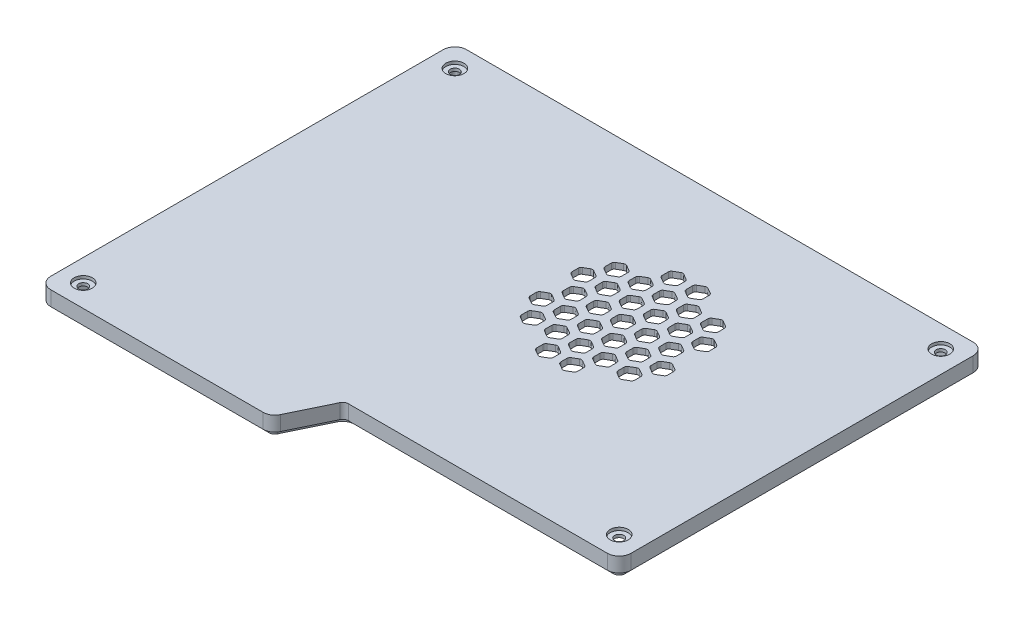
from build123d import *

# Parameters (mm, degrees)
EXTRUDE_1_DEPTH     = 5
CUT_EXTRUDE_1_DEPTH = 3
EXTRUDE_2_DEPTH     = 2
CUT_EXTRUDE_2_DEPTH = 2
FILLET_1_R          = 1
OTHER_START         = 3
OTHER_1_DEPTH       = 2
FILLET_2_R          = 4
FILLET_3_R          = 2
FILLET_4_R          = 1
FILLET_5_R          = 6
SKETCH_8_R          = 1.55
CUT_EXTRUDE_3_DEPTH = 2
SKETCH_9_R          = 3.075
CUT_EXTRUDE_4_DEPTH = 1


# Read off the part's stored shape, not the designer's step: 填充阵列1
with BuildPart() as part:
    # 草图1 → 凸台-拉伸1 (new body)
    with BuildSketch(Plane(origin=(0, 0, 0), x_dir=(1, 0, 0), z_dir=(0, 1, 0))):
        Polygon((0, 0), (0, 141.2), (180, 141.2), (180, 17), (86.8, 17), (78.6, 0), align=None)
    extrude(amount=EXTRUDE_1_DEPTH)

    # 草图4 → 切除-拉伸1 (cut)
    with BuildSketch(Plane.XZ):
        Polygon((4, -4), (4, -137.2), (176, -137.2), (176, -21), (84.288395017, -21), (76.088395017, -4), align=None)
    extrude(amount=-CUT_EXTRUDE_1_DEPTH, mode=Mode.SUBTRACT)

    # 草图5 → 凸台-拉伸2 (add)
    with BuildSketch(Plane.XZ):
        Polygon((2, -2), (2, -139.2), (178, -139.2), (178, -19), (85.544197508, -19), (77.344197508, -2), align=None)
        Polygon((4, -4), (4, -137.2), (176, -137.2), (176, -21), (84.288395017, -21), (76.088395017, -4), align=None, mode=Mode.SUBTRACT)
    extrude(amount=EXTRUDE_2_DEPTH)

    # 草图7 → 切除-拉伸2 (cut)
    with BuildSketch(Plane.XZ.offset(-3)):
        Polygon((110.5, -91.02), (113.314582562, -89.395), (113.314582562, -86.145), (110.5, -84.52), (107.685417438, -86.145), (107.685417438, -89.395), align=None)
    extrude(amount=-CUT_EXTRUDE_2_DEPTH, mode=Mode.SUBTRACT)

    # 圆角1
    fillet_1_edges = [part.edges().sort_by_distance(p)[0] for p in [
        (110.5, 4, -91.02),
        (107.685417438, 4, -89.395),
        (107.685417438, 4, -86.145),
        (110.5, 4, -84.52),
        (113.314582562, 4, -86.145),
        (113.314582562, 4, -89.395),
    ]]
    fillet(fillet_1_edges, radius=FILLET_1_R)

    # 填充阵列1 outline → 填充阵列1 (cut)
    with BuildSketch(Plane(origin=(0, 0, 0), x_dir=(1, 0, 0), z_dir=(0, 1, 0)).offset(OTHER_START)):
        with BuildLine():
            ThreePointArc((123.3, 97.832733176), (122.8, 97.966707773), (122.3, 97.832733176))
            Line((122.3, 97.832733176), (120.485417438, 96.785083446))
            ThreePointArc((120.485417438, 96.785083446), (120.119392034, 96.419058042), (119.985417438, 95.919058042))
            Line((119.985417438, 95.919058042), (119.985417438, 93.82375858))
            ThreePointArc((119.985417438, 93.82375858), (120.119392034, 93.32375858), (120.485417438, 92.957733176))
            Line((120.485417438, 92.957733176), (122.3, 91.910083446))
            ThreePointArc((122.3, 91.910083446), (122.8, 91.776108849), (123.3, 91.910083446))
            Line((123.3, 91.910083446), (125.114582562, 92.957733176))
            ThreePointArc((125.114582562, 92.957733176), (125.480607966, 93.32375858), (125.614582562, 93.82375858))
            Line((125.614582562, 93.82375858), (125.614582562, 95.919058042))
            ThreePointArc((125.614582562, 95.919058042), (125.480607966, 96.419058042), (125.114582562, 96.785083446))
            Line((125.114582562, 96.785083446), (123.3, 97.832733176))
        make_face()
        with BuildLine():
            ThreePointArc((98.7, 83.629916554), (98.2, 83.763891151), (97.7, 83.629916554))
            Line((97.7, 83.629916554), (95.885417438, 82.582266824))
            ThreePointArc((95.885417438, 82.582266824), (95.519392034, 82.21624142), (95.385417438, 81.71624142))
            Line((95.385417438, 81.71624142), (95.385417438, 79.620941958))
            ThreePointArc((95.385417438, 79.620941958), (95.519392034, 79.120941958), (95.885417438, 78.754916554))
            Line((95.885417438, 78.754916554), (97.7, 77.707266824))
            ThreePointArc((97.7, 77.707266824), (98.2, 77.573292227), (98.7, 77.707266824))
            Line((98.7, 77.707266824), (100.514582562, 78.754916554))
            ThreePointArc((100.514582562, 78.754916554), (100.880607966, 79.120941958), (101.014582562, 79.620941958))
            Line((101.014582562, 79.620941958), (101.014582562, 81.71624142))
            ThreePointArc((101.014582562, 81.71624142), (100.880607966, 82.21624142), (100.514582562, 82.582266824))
            Line((100.514582562, 82.582266824), (98.7, 83.629916554))
        make_face()
        with BuildLine():
            ThreePointArc((108.185417438, 75.480858513), (107.819392034, 75.114833109), (107.685417438, 74.614833109))
            Line((107.685417438, 74.614833109), (107.685417438, 72.519533647))
            ThreePointArc((107.685417438, 72.519533647), (107.819392034, 72.019533647), (108.185417438, 71.653508243))
            Line((108.185417438, 71.653508243), (110, 70.605858513))
            ThreePointArc((110, 70.605858513), (110.5, 70.471883916), (111, 70.605858513))
            Line((111, 70.605858513), (112.814582562, 71.653508243))
            ThreePointArc((112.814582562, 71.653508243), (113.180607966, 72.019533647), (113.314582562, 72.519533647))
            Line((113.314582562, 72.519533647), (113.314582562, 74.614833109))
            ThreePointArc((113.314582562, 74.614833109), (113.180607966, 75.114833109), (112.814582562, 75.480858513))
            Line((112.814582562, 75.480858513), (111, 76.528508243))
            ThreePointArc((111, 76.528508243), (110.5, 76.66248284), (110, 76.528508243))
            Line((110, 76.528508243), (108.185417438, 75.480858513))
        make_face()
        with BuildLine():
            ThreePointArc((108.185417438, 103.886491757), (107.819392034, 103.520466353), (107.685417438, 103.020466353))
            Line((107.685417438, 103.020466353), (107.685417438, 100.925166891))
            ThreePointArc((107.685417438, 100.925166891), (107.819392034, 100.425166891), (108.185417438, 100.059141487))
            Line((108.185417438, 100.059141487), (110, 99.011491757))
            ThreePointArc((110, 99.011491757), (110.5, 98.87751716), (111, 99.011491757))
            Line((111, 99.011491757), (112.814582562, 100.059141487))
            ThreePointArc((112.814582562, 100.059141487), (113.180607966, 100.425166891), (113.314582562, 100.925166891))
            Line((113.314582562, 100.925166891), (113.314582562, 103.020466353))
            ThreePointArc((113.314582562, 103.020466353), (113.180607966, 103.520466353), (112.814582562, 103.886491757))
            Line((112.814582562, 103.886491757), (111, 104.934141487))
            ThreePointArc((111, 104.934141487), (110.5, 105.068116084), (110, 104.934141487))
            Line((110, 104.934141487), (108.185417438, 103.886491757))
        make_face()
        with BuildLine():
            ThreePointArc((119.985417438, 79.620941958), (120.119392034, 79.120941958), (120.485417438, 78.754916554))
            Line((120.485417438, 78.754916554), (122.3, 77.707266824))
            ThreePointArc((122.3, 77.707266824), (122.8, 77.573292227), (123.3, 77.707266824))
            Line((123.3, 77.707266824), (125.114582562, 78.754916554))
            ThreePointArc((125.114582562, 78.754916554), (125.480607966, 79.120941958), (125.614582562, 79.620941958))
            Line((125.614582562, 79.620941958), (125.614582562, 81.71624142))
            ThreePointArc((125.614582562, 81.71624142), (125.480607966, 82.21624142), (125.114582562, 82.582266824))
            Line((125.114582562, 82.582266824), (123.3, 83.629916554))
            ThreePointArc((123.3, 83.629916554), (122.8, 83.763891151), (122.3, 83.629916554))
            Line((122.3, 83.629916554), (120.485417438, 82.582266824))
            ThreePointArc((120.485417438, 82.582266824), (120.119392034, 82.21624142), (119.985417438, 81.71624142))
            Line((119.985417438, 81.71624142), (119.985417438, 79.620941958))
        make_face()
        with BuildLine():
            ThreePointArc((95.385417438, 93.82375858), (95.519392034, 93.32375858), (95.885417438, 92.957733176))
            Line((95.885417438, 92.957733176), (97.7, 91.910083446))
            ThreePointArc((97.7, 91.910083446), (98.2, 91.776108849), (98.7, 91.910083446))
            Line((98.7, 91.910083446), (100.514582562, 92.957733176))
            ThreePointArc((100.514582562, 92.957733176), (100.880607966, 93.32375858), (101.014582562, 93.82375858))
            Line((101.014582562, 93.82375858), (101.014582562, 95.919058042))
            ThreePointArc((101.014582562, 95.919058042), (100.880607966, 96.419058042), (100.514582562, 96.785083446))
            Line((100.514582562, 96.785083446), (98.7, 97.832733176))
            ThreePointArc((98.7, 97.832733176), (98.2, 97.966707773), (97.7, 97.832733176))
            Line((97.7, 97.832733176), (95.885417438, 96.785083446))
            ThreePointArc((95.885417438, 96.785083446), (95.519392034, 96.419058042), (95.385417438, 95.919058042))
            Line((95.385417438, 95.919058042), (95.385417438, 93.82375858))
        make_face()
        with BuildLine():
            ThreePointArc((90.5, 97.832733176), (90, 97.966707773), (89.5, 97.832733176))
            Line((89.5, 97.832733176), (87.685417438, 96.785083446))
            ThreePointArc((87.685417438, 96.785083446), (87.319392034, 96.419058042), (87.185417438, 95.919058042))
            Line((87.185417438, 95.919058042), (87.185417438, 93.82375858))
            ThreePointArc((87.185417438, 93.82375858), (87.319392034, 93.32375858), (87.685417438, 92.957733176))
            Line((87.685417438, 92.957733176), (89.5, 91.910083446))
            ThreePointArc((89.5, 91.910083446), (90, 91.776108849), (90.5, 91.910083446))
            Line((90.5, 91.910083446), (92.314582562, 92.957733176))
            ThreePointArc((92.314582562, 92.957733176), (92.680607966, 93.32375858), (92.814582562, 93.82375858))
            Line((92.814582562, 93.82375858), (92.814582562, 95.919058042))
            ThreePointArc((92.814582562, 95.919058042), (92.680607966, 96.419058042), (92.314582562, 96.785083446))
            Line((92.314582562, 96.785083446), (90.5, 97.832733176))
        make_face()
        with BuildLine():
            ThreePointArc((102.8, 104.934141487), (102.3, 105.068116084), (101.8, 104.934141487))
            Line((101.8, 104.934141487), (99.985417438, 103.886491757))
            ThreePointArc((99.985417438, 103.886491757), (99.619392034, 103.520466353), (99.485417438, 103.020466353))
            Line((99.485417438, 103.020466353), (99.485417438, 100.925166891))
            ThreePointArc((99.485417438, 100.925166891), (99.619392034, 100.425166891), (99.985417438, 100.059141487))
            Line((99.985417438, 100.059141487), (101.8, 99.011491757))
            ThreePointArc((101.8, 99.011491757), (102.3, 98.87751716), (102.8, 99.011491757))
            Line((102.8, 99.011491757), (104.614582562, 100.059141487))
            ThreePointArc((104.614582562, 100.059141487), (104.980607966, 100.425166891), (105.114582562, 100.925166891))
            Line((105.114582562, 100.925166891), (105.114582562, 103.020466353))
            ThreePointArc((105.114582562, 103.020466353), (104.980607966, 103.520466353), (104.614582562, 103.886491757))
            Line((104.614582562, 103.886491757), (102.8, 104.934141487))
        make_face()
        with BuildLine():
            ThreePointArc((115.1, 112.035549799), (114.6, 112.169524395), (114.1, 112.035549799))
            Line((114.1, 112.035549799), (112.285417438, 110.987900068))
            ThreePointArc((112.285417438, 110.987900068), (111.919392034, 110.621874664), (111.785417438, 110.121874664))
            Line((111.785417438, 110.121874664), (111.785417438, 108.026575202))
            ThreePointArc((111.785417438, 108.026575202), (111.919392034, 107.526575202), (112.285417438, 107.160549799))
            Line((112.285417438, 107.160549799), (114.1, 106.112900068))
            ThreePointArc((114.1, 106.112900068), (114.6, 105.978925471), (115.1, 106.112900068))
            Line((115.1, 106.112900068), (116.914582562, 107.160549799))
            ThreePointArc((116.914582562, 107.160549799), (117.280607966, 107.526575202), (117.414582562, 108.026575202))
            Line((117.414582562, 108.026575202), (117.414582562, 110.121874664))
            ThreePointArc((117.414582562, 110.121874664), (117.280607966, 110.621874664), (116.914582562, 110.987900068))
            Line((116.914582562, 110.987900068), (115.1, 112.035549799))
        make_face()
        with BuildLine():
            ThreePointArc((87.685417438, 82.582266824), (87.319392034, 82.21624142), (87.185417438, 81.71624142))
            Line((87.185417438, 81.71624142), (87.185417438, 79.620941958))
            ThreePointArc((87.185417438, 79.620941958), (87.319392034, 79.120941958), (87.685417438, 78.754916554))
            Line((87.685417438, 78.754916554), (89.5, 77.707266824))
            ThreePointArc((89.5, 77.707266824), (90, 77.573292227), (90.5, 77.707266824))
            Line((90.5, 77.707266824), (92.314582562, 78.754916554))
            ThreePointArc((92.314582562, 78.754916554), (92.680607966, 79.120941958), (92.814582562, 79.620941958))
            Line((92.814582562, 79.620941958), (92.814582562, 81.71624142))
            ThreePointArc((92.814582562, 81.71624142), (92.680607966, 82.21624142), (92.314582562, 82.582266824))
            Line((92.314582562, 82.582266824), (90.5, 83.629916554))
            ThreePointArc((90.5, 83.629916554), (90, 83.763891151), (89.5, 83.629916554))
            Line((89.5, 83.629916554), (87.685417438, 82.582266824))
        make_face()
        with BuildLine():
            ThreePointArc((111.785417438, 79.620941958), (111.919392034, 79.120941958), (112.285417438, 78.754916554))
            Line((112.285417438, 78.754916554), (114.1, 77.707266824))
            ThreePointArc((114.1, 77.707266824), (114.6, 77.573292227), (115.1, 77.707266824))
            Line((115.1, 77.707266824), (116.914582562, 78.754916554))
            ThreePointArc((116.914582562, 78.754916554), (117.280607966, 79.120941958), (117.414582562, 79.620941958))
            Line((117.414582562, 79.620941958), (117.414582562, 81.71624142))
            ThreePointArc((117.414582562, 81.71624142), (117.280607966, 82.21624142), (116.914582562, 82.582266824))
            Line((116.914582562, 82.582266824), (115.1, 83.629916554))
            ThreePointArc((115.1, 83.629916554), (114.6, 83.763891151), (114.1, 83.629916554))
            Line((114.1, 83.629916554), (112.285417438, 82.582266824))
            ThreePointArc((112.285417438, 82.582266824), (111.919392034, 82.21624142), (111.785417438, 81.71624142))
            Line((111.785417438, 81.71624142), (111.785417438, 79.620941958))
        make_face()
        with BuildLine():
            ThreePointArc((124.085417438, 72.519533647), (124.219392034, 72.019533647), (124.585417438, 71.653508243))
            Line((124.585417438, 71.653508243), (126.4, 70.605858513))
            ThreePointArc((126.4, 70.605858513), (126.9, 70.471883916), (127.4, 70.605858513))
            Line((127.4, 70.605858513), (129.214582562, 71.653508243))
            ThreePointArc((129.214582562, 71.653508243), (129.580607966, 72.019533647), (129.714582562, 72.519533647))
            Line((129.714582562, 72.519533647), (129.714582562, 74.614833109))
            ThreePointArc((129.714582562, 74.614833109), (129.580607966, 75.114833109), (129.214582562, 75.480858513))
            Line((129.214582562, 75.480858513), (127.4, 76.528508243))
            ThreePointArc((127.4, 76.528508243), (126.9, 76.66248284), (126.4, 76.528508243))
            Line((126.4, 76.528508243), (124.585417438, 75.480858513))
            ThreePointArc((124.585417438, 75.480858513), (124.219392034, 75.114833109), (124.085417438, 74.614833109))
            Line((124.085417438, 74.614833109), (124.085417438, 72.519533647))
        make_face()
        with BuildLine():
            ThreePointArc((99.485417438, 86.722350269), (99.619392034, 86.222350269), (99.985417438, 85.856324865))
            Line((99.985417438, 85.856324865), (101.8, 84.808675135))
            ThreePointArc((101.8, 84.808675135), (102.3, 84.674700538), (102.8, 84.808675135))
            Line((102.8, 84.808675135), (104.614582562, 85.856324865))
            ThreePointArc((104.614582562, 85.856324865), (104.980607966, 86.222350269), (105.114582562, 86.722350269))
            Line((105.114582562, 86.722350269), (105.114582562, 88.817649731))
            ThreePointArc((105.114582562, 88.817649731), (104.980607966, 89.317649731), (104.614582562, 89.683675135))
            Line((104.614582562, 89.683675135), (102.8, 90.731324865))
            ThreePointArc((102.8, 90.731324865), (102.3, 90.865299462), (101.8, 90.731324865))
            Line((101.8, 90.731324865), (99.985417438, 89.683675135))
            ThreePointArc((99.985417438, 89.683675135), (99.619392034, 89.317649731), (99.485417438, 88.817649731))
            Line((99.485417438, 88.817649731), (99.485417438, 86.722350269))
        make_face()
        with BuildLine():
            ThreePointArc((119.2, 76.528508243), (118.7, 76.66248284), (118.2, 76.528508243))
            Line((118.2, 76.528508243), (116.385417438, 75.480858513))
            ThreePointArc((116.385417438, 75.480858513), (116.019392034, 75.114833109), (115.885417438, 74.614833109))
            Line((115.885417438, 74.614833109), (115.885417438, 72.519533647))
            ThreePointArc((115.885417438, 72.519533647), (116.019392034, 72.019533647), (116.385417438, 71.653508243))
            Line((116.385417438, 71.653508243), (118.2, 70.605858513))
            ThreePointArc((118.2, 70.605858513), (118.7, 70.471883916), (119.2, 70.605858513))
            Line((119.2, 70.605858513), (121.014582562, 71.653508243))
            ThreePointArc((121.014582562, 71.653508243), (121.380607966, 72.019533647), (121.514582562, 72.519533647))
            Line((121.514582562, 72.519533647), (121.514582562, 74.614833109))
            ThreePointArc((121.514582562, 74.614833109), (121.380607966, 75.114833109), (121.014582562, 75.480858513))
            Line((121.014582562, 75.480858513), (119.2, 76.528508243))
        make_face()
        with BuildLine():
            ThreePointArc((106.9, 69.427099932), (106.4, 69.561074529), (105.9, 69.427099932))
            Line((105.9, 69.427099932), (104.085417438, 68.379450201))
            ThreePointArc((104.085417438, 68.379450201), (103.719392034, 68.013424798), (103.585417438, 67.513424798))
            Line((103.585417438, 67.513424798), (103.585417438, 65.418125336))
            ThreePointArc((103.585417438, 65.418125336), (103.719392034, 64.918125336), (104.085417438, 64.552099932))
            Line((104.085417438, 64.552099932), (105.9, 63.504450201))
            ThreePointArc((105.9, 63.504450201), (106.4, 63.370475605), (106.9, 63.504450201))
            Line((106.9, 63.504450201), (108.714582562, 64.552099932))
            ThreePointArc((108.714582562, 64.552099932), (109.080607966, 64.918125336), (109.214582562, 65.418125336))
            Line((109.214582562, 65.418125336), (109.214582562, 67.513424798))
            ThreePointArc((109.214582562, 67.513424798), (109.080607966, 68.013424798), (108.714582562, 68.379450201))
            Line((108.714582562, 68.379450201), (106.9, 69.427099932))
        make_face()
        with BuildLine():
            ThreePointArc((131.5, 83.629916554), (131, 83.763891151), (130.5, 83.629916554))
            Line((130.5, 83.629916554), (128.685417438, 82.582266824))
            ThreePointArc((128.685417438, 82.582266824), (128.319392034, 82.21624142), (128.185417438, 81.71624142))
            Line((128.185417438, 81.71624142), (128.185417438, 79.620941958))
            ThreePointArc((128.185417438, 79.620941958), (128.319392034, 79.120941958), (128.685417438, 78.754916554))
            Line((128.685417438, 78.754916554), (130.5, 77.707266824))
            ThreePointArc((130.5, 77.707266824), (131, 77.573292227), (131.5, 77.707266824))
            Line((131.5, 77.707266824), (133.314582562, 78.754916554))
            ThreePointArc((133.314582562, 78.754916554), (133.680607966, 79.120941958), (133.814582562, 79.620941958))
            Line((133.814582562, 79.620941958), (133.814582562, 81.71624142))
            ThreePointArc((133.814582562, 81.71624142), (133.680607966, 82.21624142), (133.314582562, 82.582266824))
            Line((133.314582562, 82.582266824), (131.5, 83.629916554))
        make_face()
        with BuildLine():
            ThreePointArc((116.385417438, 89.683675135), (116.019392034, 89.317649731), (115.885417438, 88.817649731))
            Line((115.885417438, 88.817649731), (115.885417438, 86.722350269))
            ThreePointArc((115.885417438, 86.722350269), (116.019392034, 86.222350269), (116.385417438, 85.856324865))
            Line((116.385417438, 85.856324865), (118.2, 84.808675135))
            ThreePointArc((118.2, 84.808675135), (118.7, 84.674700538), (119.2, 84.808675135))
            Line((119.2, 84.808675135), (121.014582562, 85.856324865))
            ThreePointArc((121.014582562, 85.856324865), (121.380607966, 86.222350269), (121.514582562, 86.722350269))
            Line((121.514582562, 86.722350269), (121.514582562, 88.817649731))
            ThreePointArc((121.514582562, 88.817649731), (121.380607966, 89.317649731), (121.014582562, 89.683675135))
            Line((121.014582562, 89.683675135), (119.2, 90.731324865))
            ThreePointArc((119.2, 90.731324865), (118.7, 90.865299462), (118.2, 90.731324865))
            Line((118.2, 90.731324865), (116.385417438, 89.683675135))
        make_face()
        with BuildLine():
            ThreePointArc((116.385417438, 103.886491757), (116.019392034, 103.520466353), (115.885417438, 103.020466353))
            Line((115.885417438, 103.020466353), (115.885417438, 100.925166891))
            ThreePointArc((115.885417438, 100.925166891), (116.019392034, 100.425166891), (116.385417438, 100.059141487))
            Line((116.385417438, 100.059141487), (118.2, 99.011491757))
            ThreePointArc((118.2, 99.011491757), (118.7, 98.87751716), (119.2, 99.011491757))
            Line((119.2, 99.011491757), (121.014582562, 100.059141487))
            ThreePointArc((121.014582562, 100.059141487), (121.380607966, 100.425166891), (121.514582562, 100.925166891))
            Line((121.514582562, 100.925166891), (121.514582562, 103.020466353))
            ThreePointArc((121.514582562, 103.020466353), (121.380607966, 103.520466353), (121.014582562, 103.886491757))
            Line((121.014582562, 103.886491757), (119.2, 104.934141487))
            ThreePointArc((119.2, 104.934141487), (118.7, 105.068116084), (118.2, 104.934141487))
            Line((118.2, 104.934141487), (116.385417438, 103.886491757))
        make_face()
        with BuildLine():
            ThreePointArc((91.285417438, 86.722350269), (91.419392034, 86.222350269), (91.785417438, 85.856324865))
            Line((91.785417438, 85.856324865), (93.6, 84.808675135))
            ThreePointArc((93.6, 84.808675135), (94.1, 84.674700538), (94.6, 84.808675135))
            Line((94.6, 84.808675135), (96.414582562, 85.856324865))
            ThreePointArc((96.414582562, 85.856324865), (96.780607966, 86.222350269), (96.914582562, 86.722350269))
            Line((96.914582562, 86.722350269), (96.914582562, 88.817649731))
            ThreePointArc((96.914582562, 88.817649731), (96.780607966, 89.317649731), (96.414582562, 89.683675135))
            Line((96.414582562, 89.683675135), (94.6, 90.731324865))
            ThreePointArc((94.6, 90.731324865), (94.1, 90.865299462), (93.6, 90.731324865))
            Line((93.6, 90.731324865), (91.785417438, 89.683675135))
            ThreePointArc((91.785417438, 89.683675135), (91.419392034, 89.317649731), (91.285417438, 88.817649731))
            Line((91.285417438, 88.817649731), (91.285417438, 86.722350269))
        make_face()
        with BuildLine():
            ThreePointArc((103.585417438, 79.620941958), (103.719392034, 79.120941958), (104.085417438, 78.754916554))
            Line((104.085417438, 78.754916554), (105.9, 77.707266824))
            ThreePointArc((105.9, 77.707266824), (106.4, 77.573292227), (106.9, 77.707266824))
            Line((106.9, 77.707266824), (108.714582562, 78.754916554))
            ThreePointArc((108.714582562, 78.754916554), (109.080607966, 79.120941958), (109.214582562, 79.620941958))
            Line((109.214582562, 79.620941958), (109.214582562, 81.71624142))
            ThreePointArc((109.214582562, 81.71624142), (109.080607966, 82.21624142), (108.714582562, 82.582266824))
            Line((108.714582562, 82.582266824), (106.9, 83.629916554))
            ThreePointArc((106.9, 83.629916554), (106.4, 83.763891151), (105.9, 83.629916554))
            Line((105.9, 83.629916554), (104.085417438, 82.582266824))
            ThreePointArc((104.085417438, 82.582266824), (103.719392034, 82.21624142), (103.585417438, 81.71624142))
            Line((103.585417438, 81.71624142), (103.585417438, 79.620941958))
        make_face()
        with BuildLine():
            ThreePointArc((115.1, 69.427099932), (114.6, 69.561074529), (114.1, 69.427099932))
            Line((114.1, 69.427099932), (112.285417438, 68.379450201))
            ThreePointArc((112.285417438, 68.379450201), (111.919392034, 68.013424798), (111.785417438, 67.513424798))
            Line((111.785417438, 67.513424798), (111.785417438, 65.418125336))
            ThreePointArc((111.785417438, 65.418125336), (111.919392034, 64.918125336), (112.285417438, 64.552099932))
            Line((112.285417438, 64.552099932), (114.1, 63.504450201))
            ThreePointArc((114.1, 63.504450201), (114.6, 63.370475605), (115.1, 63.504450201))
            Line((115.1, 63.504450201), (116.914582562, 64.552099932))
            ThreePointArc((116.914582562, 64.552099932), (117.280607966, 64.918125336), (117.414582562, 65.418125336))
            Line((117.414582562, 65.418125336), (117.414582562, 67.513424798))
            ThreePointArc((117.414582562, 67.513424798), (117.280607966, 68.013424798), (116.914582562, 68.379450201))
            Line((116.914582562, 68.379450201), (115.1, 69.427099932))
        make_face()
        with BuildLine():
            ThreePointArc((112.285417438, 96.785083446), (111.919392034, 96.419058042), (111.785417438, 95.919058042))
            Line((111.785417438, 95.919058042), (111.785417438, 93.82375858))
            ThreePointArc((111.785417438, 93.82375858), (111.919392034, 93.32375858), (112.285417438, 92.957733176))
            Line((112.285417438, 92.957733176), (114.1, 91.910083446))
            ThreePointArc((114.1, 91.910083446), (114.6, 91.776108849), (115.1, 91.910083446))
            Line((115.1, 91.910083446), (116.914582562, 92.957733176))
            ThreePointArc((116.914582562, 92.957733176), (117.280607966, 93.32375858), (117.414582562, 93.82375858))
            Line((117.414582562, 93.82375858), (117.414582562, 95.919058042))
            ThreePointArc((117.414582562, 95.919058042), (117.280607966, 96.419058042), (116.914582562, 96.785083446))
            Line((116.914582562, 96.785083446), (115.1, 97.832733176))
            ThreePointArc((115.1, 97.832733176), (114.6, 97.966707773), (114.1, 97.832733176))
            Line((114.1, 97.832733176), (112.285417438, 96.785083446))
        make_face()
        with BuildLine():
            ThreePointArc((99.485417438, 72.519533647), (99.619392034, 72.019533647), (99.985417438, 71.653508243))
            Line((99.985417438, 71.653508243), (101.8, 70.605858513))
            ThreePointArc((101.8, 70.605858513), (102.3, 70.471883916), (102.8, 70.605858513))
            Line((102.8, 70.605858513), (104.614582562, 71.653508243))
            ThreePointArc((104.614582562, 71.653508243), (104.980607966, 72.019533647), (105.114582562, 72.519533647))
            Line((105.114582562, 72.519533647), (105.114582562, 74.614833109))
            ThreePointArc((105.114582562, 74.614833109), (104.980607966, 75.114833109), (104.614582562, 75.480858513))
            Line((104.614582562, 75.480858513), (102.8, 76.528508243))
            ThreePointArc((102.8, 76.528508243), (102.3, 76.66248284), (101.8, 76.528508243))
            Line((101.8, 76.528508243), (99.985417438, 75.480858513))
            ThreePointArc((99.985417438, 75.480858513), (99.619392034, 75.114833109), (99.485417438, 74.614833109))
            Line((99.485417438, 74.614833109), (99.485417438, 72.519533647))
        make_face()
        with BuildLine():
            ThreePointArc((127.4, 104.934141487), (126.9, 105.068116084), (126.4, 104.934141487))
            Line((126.4, 104.934141487), (124.585417438, 103.886491757))
            ThreePointArc((124.585417438, 103.886491757), (124.219392034, 103.520466353), (124.085417438, 103.020466353))
            Line((124.085417438, 103.020466353), (124.085417438, 100.925166891))
            ThreePointArc((124.085417438, 100.925166891), (124.219392034, 100.425166891), (124.585417438, 100.059141487))
            Line((124.585417438, 100.059141487), (126.4, 99.011491757))
            ThreePointArc((126.4, 99.011491757), (126.9, 98.87751716), (127.4, 99.011491757))
            Line((127.4, 99.011491757), (129.214582562, 100.059141487))
            ThreePointArc((129.214582562, 100.059141487), (129.580607966, 100.425166891), (129.714582562, 100.925166891))
            Line((129.714582562, 100.925166891), (129.714582562, 103.020466353))
            ThreePointArc((129.714582562, 103.020466353), (129.580607966, 103.520466353), (129.214582562, 103.886491757))
            Line((129.214582562, 103.886491757), (127.4, 104.934141487))
        make_face()
        with BuildLine():
            ThreePointArc((124.585417438, 89.683675135), (124.219392034, 89.317649731), (124.085417438, 88.817649731))
            Line((124.085417438, 88.817649731), (124.085417438, 86.722350269))
            ThreePointArc((124.085417438, 86.722350269), (124.219392034, 86.222350269), (124.585417438, 85.856324865))
            Line((124.585417438, 85.856324865), (126.4, 84.808675135))
            ThreePointArc((126.4, 84.808675135), (126.9, 84.674700538), (127.4, 84.808675135))
            Line((127.4, 84.808675135), (129.214582562, 85.856324865))
            ThreePointArc((129.214582562, 85.856324865), (129.580607966, 86.222350269), (129.714582562, 86.722350269))
            Line((129.714582562, 86.722350269), (129.714582562, 88.817649731))
            ThreePointArc((129.714582562, 88.817649731), (129.580607966, 89.317649731), (129.214582562, 89.683675135))
            Line((129.214582562, 89.683675135), (127.4, 90.731324865))
            ThreePointArc((127.4, 90.731324865), (126.9, 90.865299462), (126.4, 90.731324865))
            Line((126.4, 90.731324865), (124.585417438, 89.683675135))
        make_face()
        with BuildLine():
            ThreePointArc((131.5, 97.832733176), (131, 97.966707773), (130.5, 97.832733176))
            Line((130.5, 97.832733176), (128.685417438, 96.785083446))
            ThreePointArc((128.685417438, 96.785083446), (128.319392034, 96.419058042), (128.185417438, 95.919058042))
            Line((128.185417438, 95.919058042), (128.185417438, 93.82375858))
            ThreePointArc((128.185417438, 93.82375858), (128.319392034, 93.32375858), (128.685417438, 92.957733176))
            Line((128.685417438, 92.957733176), (130.5, 91.910083446))
            ThreePointArc((130.5, 91.910083446), (131, 91.776108849), (131.5, 91.910083446))
            Line((131.5, 91.910083446), (133.314582562, 92.957733176))
            ThreePointArc((133.314582562, 92.957733176), (133.680607966, 93.32375858), (133.814582562, 93.82375858))
            Line((133.814582562, 93.82375858), (133.814582562, 95.919058042))
            ThreePointArc((133.814582562, 95.919058042), (133.680607966, 96.419058042), (133.314582562, 96.785083446))
            Line((133.314582562, 96.785083446), (131.5, 97.832733176))
        make_face()
        with BuildLine():
            ThreePointArc((94.6, 76.528508243), (94.1, 76.66248284), (93.6, 76.528508243))
            Line((93.6, 76.528508243), (91.785417438, 75.480858513))
            ThreePointArc((91.785417438, 75.480858513), (91.419392034, 75.114833109), (91.285417438, 74.614833109))
            Line((91.285417438, 74.614833109), (91.285417438, 72.519533647))
            ThreePointArc((91.285417438, 72.519533647), (91.419392034, 72.019533647), (91.785417438, 71.653508243))
            Line((91.785417438, 71.653508243), (93.6, 70.605858513))
            ThreePointArc((93.6, 70.605858513), (94.1, 70.471883916), (94.6, 70.605858513))
            Line((94.6, 70.605858513), (96.414582562, 71.653508243))
            ThreePointArc((96.414582562, 71.653508243), (96.780607966, 72.019533647), (96.914582562, 72.519533647))
            Line((96.914582562, 72.519533647), (96.914582562, 74.614833109))
            ThreePointArc((96.914582562, 74.614833109), (96.780607966, 75.114833109), (96.414582562, 75.480858513))
            Line((96.414582562, 75.480858513), (94.6, 76.528508243))
        make_face()
        with BuildLine():
            ThreePointArc((91.285417438, 100.925166891), (91.419392034, 100.425166891), (91.785417438, 100.059141487))
            Line((91.785417438, 100.059141487), (93.6, 99.011491757))
            ThreePointArc((93.6, 99.011491757), (94.1, 98.87751716), (94.6, 99.011491757))
            Line((94.6, 99.011491757), (96.414582562, 100.059141487))
            ThreePointArc((96.414582562, 100.059141487), (96.780607966, 100.425166891), (96.914582562, 100.925166891))
            Line((96.914582562, 100.925166891), (96.914582562, 103.020466353))
            ThreePointArc((96.914582562, 103.020466353), (96.780607966, 103.520466353), (96.414582562, 103.886491757))
            Line((96.414582562, 103.886491757), (94.6, 104.934141487))
            ThreePointArc((94.6, 104.934141487), (94.1, 105.068116084), (93.6, 104.934141487))
            Line((93.6, 104.934141487), (91.785417438, 103.886491757))
            ThreePointArc((91.785417438, 103.886491757), (91.419392034, 103.520466353), (91.285417438, 103.020466353))
            Line((91.285417438, 103.020466353), (91.285417438, 100.925166891))
        make_face()
        with BuildLine():
            ThreePointArc((103.585417438, 93.82375858), (103.719392034, 93.32375858), (104.085417438, 92.957733176))
            Line((104.085417438, 92.957733176), (105.9, 91.910083446))
            ThreePointArc((105.9, 91.910083446), (106.4, 91.776108849), (106.9, 91.910083446))
            Line((106.9, 91.910083446), (108.714582562, 92.957733176))
            ThreePointArc((108.714582562, 92.957733176), (109.080607966, 93.32375858), (109.214582562, 93.82375858))
            Line((109.214582562, 93.82375858), (109.214582562, 95.919058042))
            ThreePointArc((109.214582562, 95.919058042), (109.080607966, 96.419058042), (108.714582562, 96.785083446))
            Line((108.714582562, 96.785083446), (106.9, 97.832733176))
            ThreePointArc((106.9, 97.832733176), (106.4, 97.966707773), (105.9, 97.832733176))
            Line((105.9, 97.832733176), (104.085417438, 96.785083446))
            ThreePointArc((104.085417438, 96.785083446), (103.719392034, 96.419058042), (103.585417438, 95.919058042))
            Line((103.585417438, 95.919058042), (103.585417438, 93.82375858))
        make_face()
        with BuildLine():
            ThreePointArc((104.085417438, 110.987900068), (103.719392034, 110.621874664), (103.585417438, 110.121874664))
            Line((103.585417438, 110.121874664), (103.585417438, 108.026575202))
            ThreePointArc((103.585417438, 108.026575202), (103.719392034, 107.526575202), (104.085417438, 107.160549799))
            Line((104.085417438, 107.160549799), (105.9, 106.112900068))
            ThreePointArc((105.9, 106.112900068), (106.4, 105.978925471), (106.9, 106.112900068))
            Line((106.9, 106.112900068), (108.714582562, 107.160549799))
            ThreePointArc((108.714582562, 107.160549799), (109.080607966, 107.526575202), (109.214582562, 108.026575202))
            Line((109.214582562, 108.026575202), (109.214582562, 110.121874664))
            ThreePointArc((109.214582562, 110.121874664), (109.080607966, 110.621874664), (108.714582562, 110.987900068))
            Line((108.714582562, 110.987900068), (106.9, 112.035549799))
            ThreePointArc((106.9, 112.035549799), (106.4, 112.169524395), (105.9, 112.035549799))
            Line((105.9, 112.035549799), (104.085417438, 110.987900068))
        make_face()
    extrude(amount=OTHER_1_DEPTH, mode=Mode.SUBTRACT)

    # 圆角2
    fillet_2_edges = [part.edges().sort_by_distance(p)[0] for p in [
        (0, 2.5, 0),
        (0, 2.5, -141.2),
        (180, 2.5, -141.2),
        (180, 2.5, -17),
        (78.6, 2.5, 0),
        (85.544197508, -1, -19),
    ]]
    fillet(fillet_2_edges, radius=FILLET_2_R)

    # 圆角3
    fillet_3_edges = [part.edges().sort_by_distance(p)[0] for p in [
        (86.8, 2.5, -17),
        (77.344197508, -1, -2),
        (2, -1, -2),
        (2, -1, -139.2),
        (178, -1, -139.2),
        (178, -1, -19),
    ]]
    fillet(fillet_3_edges, radius=FILLET_3_R)

    # 圆角4
    fillet_4_edges = [part.edges().sort_by_distance(p)[0] for p in [
        (4, 0.5, -4),
        (76.088395017, 0.5, -4),
        (176, 0.5, -21),
        (176, 0.5, -137.2),
        (4, 0.5, -137.2),
    ]]
    fillet(fillet_4_edges, radius=FILLET_4_R)

    # 圆角5
    fillet_5_edges = [part.edges().sort_by_distance(p)[0] for p in [
        (84.288395017, 0.5, -21),
    ]]
    fillet(fillet_5_edges, radius=FILLET_5_R)

    # 草图8 → 切除-拉伸3 (cut)
    with BuildSketch(Plane.XZ.offset(-3)):
        with Locations(Location((7.5, -7.5, 0), (0, 0, 270))):
            Circle(SKETCH_8_R)
        with Locations(Location((172.5, -24.5, 0), (0, 0, 270))):
            Circle(SKETCH_8_R)
        with Locations(Location((172.5, -133.7, 0), (0, 0, 270))):
            Circle(SKETCH_8_R)
        with Locations(Location((7.5, -133.7, 0), (0, 0, 270))):
            Circle(SKETCH_8_R)
    extrude(amount=-CUT_EXTRUDE_3_DEPTH, mode=Mode.SUBTRACT)

    # 草图9 → 切除-拉伸4 (cut)
    with BuildSketch(Plane(origin=(0, 5, 0), x_dir=(1, 0, 0), z_dir=(0, 1, 0))):
        with Locations(Location((7.5, 133.7, 0), (0, 0, 270))):
            Circle(SKETCH_9_R)
        with Locations(Location((172.5, 133.7, 0), (0, 0, 270))):
            Circle(SKETCH_9_R)
        with Locations(Location((172.5, 24.5, 0), (0, 0, 270))):
            Circle(SKETCH_9_R)
        with Locations(Location((7.5, 7.5, 0), (0, 0, 270))):
            Circle(SKETCH_9_R)
    extrude(amount=-CUT_EXTRUDE_4_DEPTH, mode=Mode.SUBTRACT)


solid = part.part
